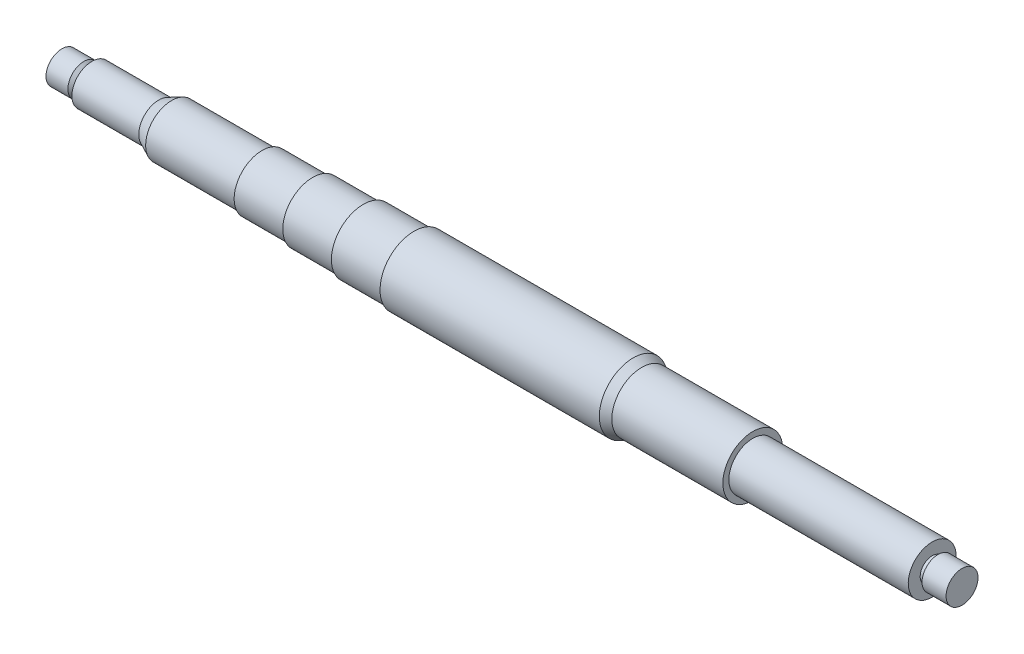
from build123d import *


with BuildPart() as part:
    # Sketch1 → Revolve1 (revolve)
    with BuildSketch(Plane.XY):
        Polygon((0, 0), (0, 4), (5.5, 4), (6.5, 3), (7.5, 3), (7.5, 5), (24.283239619, 5), (27.5, 6.5), (37.5, 6.5), (50.2, 6.5), (50.2, 7), (62.9, 7), (62.9, 7.5), (75.6, 7.5), (75.6, 8), (88.3, 8), (88.3, 8.5), (143.3, 8.5), (145.444506921, 7.5), (173.3, 7.5), (173.3, 6), (218.3, 6), (218.3, 3), (219.3, 3), (219.76815906, 4.003970343), (225.8, 4.003970343), (225.8, 0), align=None)
    revolve(axis=Axis((0, 0, 0), (1, 0, 0)))


solid = part.part
